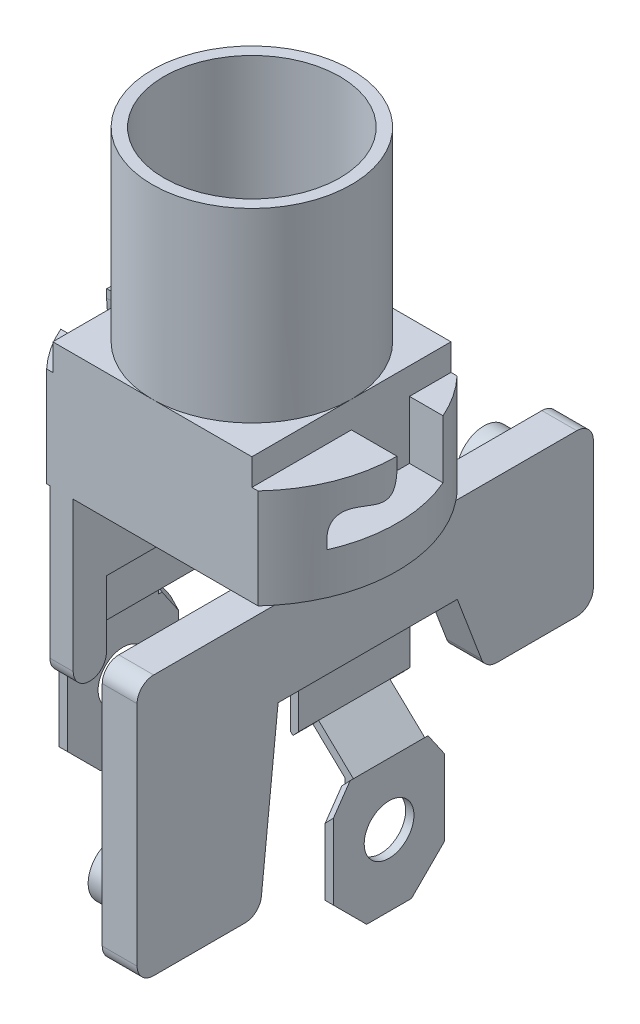
from build123d import *

# Parameters (mm, degrees)
SKETCH1_R                = 6
SKETCH1_R_2              = 5.3
BOSS_EXTRUDE1_DEPTH      = 11.2
SKETCH2_W                = 12
SKETCH2_H                = 12
BOSS_EXTRUDE2_DEPTH      = 1.6
SKETCH3_W                = 17.5
SKETCH3_H                = 12
BOSS_EXTRUDE3_DEPTH      = 6
CUT_EXTRUDE1_DEPTH       = 2.75
CIRPATTERN8_COUNT        = 2
SKETCH5_OUTSIDE_W        = 25.17
SKETCH5_OUTSIDE_H        = 19.67
SKETCH5_OUTSIDE_R        = 8.75
CUT_EXTRUDE2_DEPTH       = 22.587091205
BOSS_EXTRUDE4_DEPTH      = 5
SKETCH7_W                = 1.4
SKETCH7_H                = 2
BOSS_EXTRUDE5_DEPTH      = 5
SKETCH8_W                = 2.1
SKETCH8_H                = 27.5
BOSS_EXTRUDE6_DEPTH      = 15.7
CUT_EXTRUDE3_DEPTH       = 3
FILLET1_R                = 1
BOSS_EXTRUDE7_DEPTH      = 3.35
SKETCH12_W               = 2.9
SKETCH12_H               = 1.2
CUT_EXTRUDE4_DEPTH       = 6.7
CHAMFER1_SIZE            = 1
CHAMFER2_SIZE            = 2
SKETCH13_R               = 1.5
CUT_EXTRUDE5_DEPTH       = 6.7
CHAMFER1_OF_MIRROR3_SIZE = 1
CHAMFER2_OF_MIRROR3_SIZE = 2
SKETCH14_R               = 1.65
BOSS_EXTRUDE8_DEPTH      = 2


# Some blends are built 0.0001 mm under size
with BuildPart() as part:
    # Sketch1 → Boss-Extrude1 (new body)
    with BuildSketch(Plane(origin=(0, 0, 0), x_dir=(1, 0, 0), z_dir=(0, 1, 0))):
        with Locations(Location((0, 0, 0), (0, 0, 270))):
            Circle(SKETCH1_R)
        with Locations(Location((0, 0, 0), (0, 0, 270))):
            Circle(SKETCH1_R_2, mode=Mode.SUBTRACT)
    extrude(amount=BOSS_EXTRUDE1_DEPTH)

    # Sketch2 → Boss-Extrude2 (add)
    with BuildSketch(Plane.XZ):
        Rectangle(SKETCH2_W, SKETCH2_H)
    extrude(amount=BOSS_EXTRUDE2_DEPTH)

    # Sketch3 → Boss-Extrude3 (add)
    with BuildSketch(Plane.XZ.offset(1.6)):
        Rectangle(SKETCH3_W, SKETCH3_H)
    extrude(amount=BOSS_EXTRUDE3_DEPTH)

    # Sketch4 → Cut-Extrude1 (cut)
    with BuildSketch(Plane.ZY.offset(8.75)):
        with BuildLine():
            Line((3.5, -1.6), (3.5, -5.1))
            Line((3.5, -5.1), (-3.5, -5.1))
            Line((-3.5, -5.1), (-3.5, -4.6))
            add(Edge.make_bspline(
                [(-3.5, -4.6), (-3.5, -3.681946605), (-2.636311327, -2.93147779), (-0.605865115, -3.976002744), (0, -3.206492633), (0, -2.1)],
                knots=[0, 0, 0, 0, 0.306820438, 0.673720389, 1, 1, 1, 1], degree=3))
            Line((0, -2.1), (0, -1.6))
            Line((0, -1.6), (3.5, -1.6))
        make_face()
    cut_extrude1 = extrude(amount=-CUT_EXTRUDE1_DEPTH, mode=Mode.SUBTRACT)

    # CirPattern8: Cut-Extrude1 ×2 about axis
    cirpattern8_axis = Axis((0, 11.2, 0), (0, -1, 0))
    for i in range(1, CIRPATTERN8_COUNT):
        add(cut_extrude1.rotate(cirpattern8_axis, i * 360 / CIRPATTERN8_COUNT), mode=Mode.SUBTRACT)

    # Sketch5 outside → Cut-Extrude2 (cut, through all)
    with BuildSketch(Plane(origin=(0, 11.2, 0), x_dir=(1, 0, 0), z_dir=(0, 1, 0))):
        Rectangle(SKETCH5_OUTSIDE_W, SKETCH5_OUTSIDE_H)
        Circle(SKETCH5_OUTSIDE_R, mode=Mode.SUBTRACT)
    extrude(amount=-CUT_EXTRUDE2_DEPTH, mode=Mode.SUBTRACT)

    # Sketch6 → Boss-Extrude4 (add)
    with BuildSketch(Plane.XZ.offset(7.6)):
        Polygon((-6.168869601, -4.35), (-6.168869601, 4.35), (-7.768869601, 3), (-7.768869601, -3), align=None)
        Polygon((-4.768869601, -6), (-4.768869601, 6), (-6.168869601, 6), (-6.168869601, 4.35), (-6.168869601, -4.35), (-6.168869601, -6), align=None)
    extrude(amount=BOSS_EXTRUDE4_DEPTH)

    # Sketch7 → Boss-Extrude5 (add)
    with BuildSketch(Plane.XZ.offset(12.6)):
        with Locations((-5.468869601, 5)):
            Rectangle(SKETCH7_W, SKETCH7_H)
        with Locations((-5.468869601, -5)):
            Rectangle(SKETCH7_W, SKETCH7_H)
    extrude(amount=BOSS_EXTRUDE5_DEPTH)

    # Sketch8 → Boss-Extrude6 (add)
    with BuildSketch(Plane.XZ.offset(7.6)):
        with Locations((5.781130399, 0)):
            Rectangle(SKETCH8_W, SKETCH8_H)
    extrude(amount=BOSS_EXTRUDE6_DEPTH)

    # Sketch9 → Cut-Extrude3 (cut)
    with BuildSketch(Plane(origin=(6.831130399, 0, 0), x_dir=(0, 0, -1), z_dir=(1, 0, 0))):
        Polygon((-6.35, -23.3), (-5.25, -12.8), (5.55, -12.8), (7.25, -17.3), (13.75, -17.3), (13.75, -23.3), align=None)
    extrude(amount=-CUT_EXTRUDE3_DEPTH, mode=Mode.SUBTRACT)

    # Fillet1
    fillet1_edges = [part.edges().sort_by_distance(p)[0] for p in [
        (5.781130399, -7.6, 13.75),
        (5.781130399, -7.6, -13.75),
        (-5.468869601, -17.6, -6),
        (-5.468869601, -17.6, -4),
        (-5.468869601, -17.6, 6),
        (-5.468869601, -17.6, 4),
        (5.781130399, -23.3, 13.75),
        (5.781130399, -23.3, 6.35),
        (5.781130399, -17.3, -7.25),
        (5.781130399, -17.3, -13.75),
    ]]
    fillet(fillet1_edges, radius=FILLET1_R - 0.0001)  # a hair under: the kernel refuses the full size

    # Sketch11 → Boss-Extrude7 (add, symmetric)
    with BuildSketch(Plane.XY):
        Polygon((-6.168869601, -12.6), (-6.168869601, -15.599847371), (-8.268869601, -17.599847371), (-8.268869601, -25.599847371), (-7.768869601, -25.599847371), (-7.768869601, -17.814133086), (-5.668869601, -15.814133086), (-5.668869601, -12.6), align=None)
    boss_extrude7 = extrude(amount=BOSS_EXTRUDE7_DEPTH, both=True)

    # Sketch12 → Cut-Extrude4 (cut)
    with BuildSketch(Plane(origin=(4.856585084, -5.099414338, 0), x_dir=(0.7241379310344822, 0.6896551724137937, 0), z_dir=(-0.6896551724137937, 0.7241379310344822, 0))):
        with Locations((-16.675627899, 2.75)):
            Rectangle(SKETCH12_W, SKETCH12_H)
        with Locations((-16.675627899, -2.75)):
            Rectangle(SKETCH12_W, SKETCH12_H)
    cut_extrude4 = extrude(amount=-CUT_EXTRUDE4_DEPTH, mode=Mode.SUBTRACT)

    # Chamfer1
    # the kernel refuses this chamfer: 1 mm, written as the material it takes off along each edge
    with BuildSketch(Plane(origin=(-10.042444076, -15.737594173, -3.35), x_dir=(0.019910807200768887, 0.018962673524541826, 0.9996219169112968), z_dir=(0.6896551724137937, -0.7241379310344822, 0))) as chamfer1_piece_1:
        Polygon((CHAMFER1_SIZE * 0.999621916911, CHAMFER1_SIZE * 0.0274958766106), (-CHAMFER1_SIZE * 0.0274958766106, CHAMFER1_SIZE * 0.999621916911), (0, 0), align=None)
    extrude(amount=5.868365976, mode=Mode.SUBTRACT)
    with BuildSketch(Plane(origin=(-10.042444076, -15.737594173, 3.35), x_dir=(0.019910807200768887, 0.018962673524541826, -0.9996219169112968), z_dir=(0.6896551724137937, -0.7241379310344822, 0))) as chamfer1_piece_2:
        Polygon((CHAMFER1_SIZE * 0.999621916911, -CHAMFER1_SIZE * 0.0274958766106), (-CHAMFER1_SIZE * 0.0274958766106, -CHAMFER1_SIZE * 0.999621916911), (0, 0), align=None)
    extrude(amount=5.868365976, mode=Mode.SUBTRACT)

    # Chamfer2
    chamfer2_edges = [part.edges().sort_by_distance(p)[0] for p in [
        (-8.018869601, -25.599847371, -3.35),
        (-8.018869601, -25.599847371, 3.35),
    ]]
    chamfer(chamfer2_edges, length=CHAMFER2_SIZE)

    # Sketch13 → Cut-Extrude5 (cut)
    with BuildSketch(Plane.ZY.offset(8.268869601)):
        with Locations((0, -21.324847371)):
            Circle(SKETCH13_R)
    cut_extrude5 = extrude(amount=-CUT_EXTRUDE5_DEPTH, mode=Mode.SUBTRACT)

    # Mirror3: Boss-Extrude7, Cut-Extrude4, Cut-Extrude5 across plane
    add(boss_extrude7.mirror(Plane(origin=(0, 0, 0), x_dir=(0, 0, 1), z_dir=(1, 0, 0))))
    add(cut_extrude4.mirror(Plane(origin=(0, 0, 0), x_dir=(0, 0, 1), z_dir=(1, 0, 0))), mode=Mode.SUBTRACT)
    add(cut_extrude5.mirror(Plane(origin=(0, 0, 0), x_dir=(0, 0, 1), z_dir=(1, 0, 0))), mode=Mode.SUBTRACT)

    # Chamfer1 of Mirror3
    # the kernel refuses this chamfer: 1 mm, written as the material it takes off along each edge
    with BuildSketch(Plane(origin=(10.042444076, -15.737594173, -3.35), x_dir=(0.7238641467288695, -0.6893944254560673, -0.02749587661058651), z_dir=(-0.6896551724137937, -0.7241379310344822, 0))) as chamfer1_of_mirror3_piece_1:
        Polygon((CHAMFER1_OF_MIRROR3_SIZE * 0.999621916911, CHAMFER1_OF_MIRROR3_SIZE * 0.0274958766106), (-CHAMFER1_OF_MIRROR3_SIZE * 0.0274958766106, CHAMFER1_OF_MIRROR3_SIZE * 0.999621916911), (0, 0), align=None)
    extrude(amount=5.868365976, mode=Mode.SUBTRACT)
    with BuildSketch(Plane(origin=(10.042444076, -15.737594173, 3.35), x_dir=(0.7238641467288695, -0.6893944254560673, 0.02749587661058651), z_dir=(-0.6896551724137937, -0.7241379310344822, 0))) as chamfer1_of_mirror3_piece_2:
        Polygon((CHAMFER1_OF_MIRROR3_SIZE * 0.999621916911, -CHAMFER1_OF_MIRROR3_SIZE * 0.0274958766106), (-CHAMFER1_OF_MIRROR3_SIZE * 0.0274958766106, -CHAMFER1_OF_MIRROR3_SIZE * 0.999621916911), (0, 0), align=None)
    extrude(amount=5.868365976, mode=Mode.SUBTRACT)

    # Chamfer2 of Mirror3
    chamfer2_of_mirror3_edges = [part.edges().sort_by_distance(p)[0] for p in [
        (8.018869601, -25.599847371, -3.35),
        (8.018869601, -25.599847371, 3.35),
    ]]
    chamfer(chamfer2_of_mirror3_edges, length=CHAMFER2_OF_MIRROR3_SIZE)

    # Sketch14 → Boss-Extrude8 (add)
    with BuildSketch(Plane.ZY.offset(-4.731130399)):
        with Locations(Location((-11.25, -10.3, 0), (0, 0, 180))):
            Circle(SKETCH14_R)
        with Locations(Location((10.95, -20.6, 0), (0, 0, 180))):
            Circle(SKETCH14_R)
    extrude(amount=BOSS_EXTRUDE8_DEPTH)


solid = part.part
